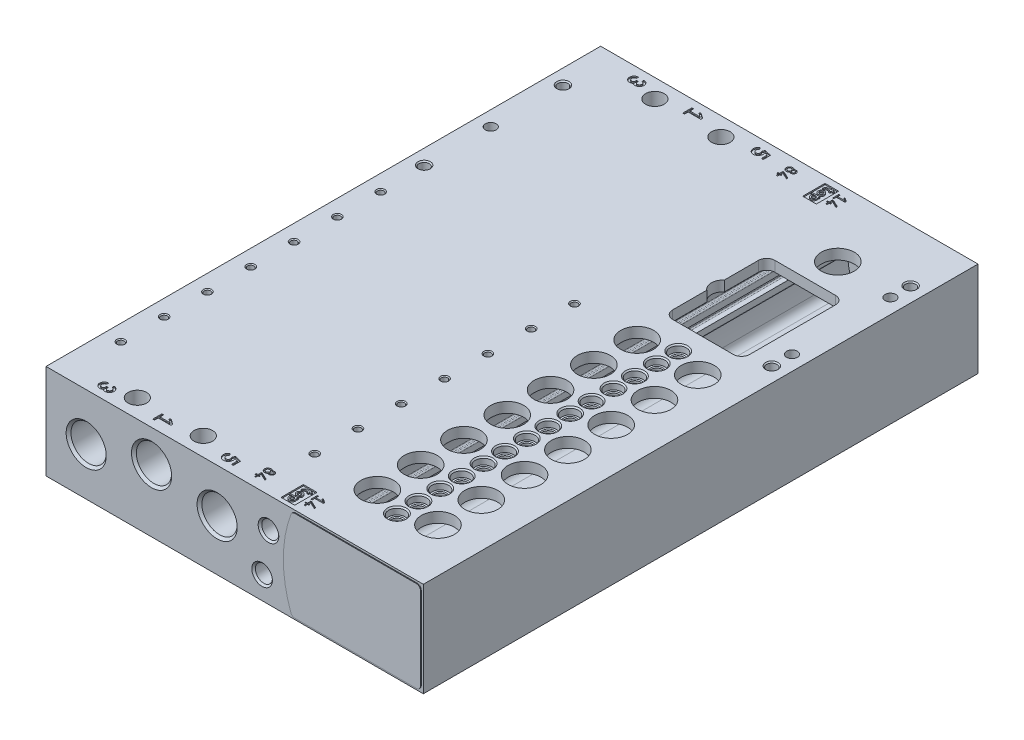
from build123d import *

# Parameters (mm, degrees)
SKIZZE1_W                             = 91.5
SKIZZE1_H                             = 23
AUFSATZ_LINEAR_AUSTRAGEN1_DEPTH       = 134.5
BOHRUNG1_D                            = 4.5
LINEARES_MUSTER1_COUNT                = 2
LINEARES_MUSTER1_PITCH                = 16
LINEARES_MUSTER1_COUNT_DIR2           = 2
LINEARES_MUSTER1_PITCH_DIR2           = 125.5
BOHRUNG2_D                            = 8
BOHRUNG2_DEPTH                        = 5
LINEARES_MUSTER2_COUNT                = 7
LINEARES_MUSTER2_PITCH                = 10.5
BOHRUNG3_D                            = 8
BOHRUNG3_DEPTH                        = 5
LINEARES_MUSTER3_COUNT                = 7
LINEARES_MUSTER3_PITCH                = 10.5
LINEARES_MUSTER4_COUNT                = 7
LINEARES_MUSTER4_PITCH                = 10.5
LINEARES_MUSTER5_COUNT                = 7
LINEARES_MUSTER5_PITCH                = 10.5
LINEARES_MUSTER6_COUNT                = 7
LINEARES_MUSTER6_PITCH                = 10.5
LINEARES_MUSTER7_COUNT                = 7
LINEARES_MUSTER7_PITCH                = 10.5
BOHRUNG6_D                            = 8
BOHRUNG6_DEPTH                        = 2.5
LINEARES_MUSTER8_COUNT                = 2
LINEARES_MUSTER8_PITCH                = 84.3
LINEARES_MUSTER8_COUNT_DIR2           = 2
LINEARES_MUSTER8_PITCH_DIR2           = 33.65
SKIZZE36_R                            = 1.3
SCHNITT_LINEAR_AUSTRAGEN1_DEPTH       = 11
LINEARES_MUSTER9_COUNT                = 2
LINEARES_MUSTER9_PITCH                = 85.236435871
LINEARES_MUSTER9_COUNT_DIR2           = 2
LINEARES_MUSTER9_PITCH_DIR2           = 85.047354456
SCHNITT_LINEAR_AUSTRAGEN2_DEPTH       = 5
LINEARES_MUSTER10_COUNT               = 7
LINEARES_MUSTER10_PITCH               = 10.5
LINEARES_MUSTER11_COUNT               = 7
LINEARES_MUSTER11_PITCH               = 10.5
AUFSATZ_LINEAR_AUSTRAGEN2_DEPTH       = 0.2
AUFSATZ_LINEAR_START                  = 0.2
AUFSATZ_LINEAR_AUSTRAGEN3_DEPTH       = 0.2
SCHNITT_LINEAR_AUSTRAGEN3_DEPTH       = 0.3
SCHNITT_LINEAR_AUSTRAGEN3_DEPTH_BACK  = 0.3
SCHNITT_LINEAR_AUSTRAGEN4_DEPTH       = 0.3
SCHNITT_LINEAR_AUSTRAGEN4_DEPTH_BACK  = 0.3
SCHNITT_LINEAR_AUSTRAGEN5_DEPTH       = 0.3
SCHNITT_LINEAR_AUSTRAGEN5_DEPTH_BACK  = 0.3
SKIZZE49_W                            = 3.3
SKIZZE49_H                            = 5.4
SCHNITT_LINEAR_AUSTRAGEN6_DEPTH       = 0.3
SCHNITT_LINEAR_AUSTRAGEN6_DEPTH_BACK  = 0.3
SKIZZE50_R                            = 0.35
SKIZZE50_R_2                          = 0.45
SCHNITT_LINEAR_AUSTRAGEN7_DEPTH       = 0.3
SCHNITT_LINEAR_AUSTRAGEN7_DEPTH_BACK  = 0.3
SCHNITT_LINEAR_AUSTRAGEN8_DEPTH       = 0.3
SCHNITT_LINEAR_AUSTRAGEN8_DEPTH_BACK  = 0.3
SCHNITT_LINEAR_AUSTRAGEN9_DEPTH       = 0.3
SCHNITT_LINEAR_AUSTRAGEN9_DEPTH_BACK  = 0.3
SCHNITT_LINEAR_AUSTRAGEN10_DEPTH      = 0.3
SCHNITT_LINEAR_AUSTRAGEN10_DEPTH_BACK = 0.3
SCHNITT_LINEAR_AUSTRAGEN11_DEPTH      = 0.3
SCHNITT_LINEAR_AUSTRAGEN11_DEPTH_BACK = 0.3
SCHNITT_LINEAR_AUSTRAGEN12_DEPTH      = 0.3
SCHNITT_LINEAR_AUSTRAGEN12_DEPTH_BACK = 0.3
SCHNITT_LINEAR_AUSTRAGEN13_DEPTH      = 0.3
SCHNITT_LINEAR_AUSTRAGEN13_DEPTH_BACK = 0.3
SKIZZE57_W                            = 3.3
SKIZZE57_H                            = 5.4
SCHNITT_LINEAR_AUSTRAGEN14_DEPTH      = 0.3
SCHNITT_LINEAR_AUSTRAGEN14_DEPTH_BACK = 0.3
SKIZZE58_R                            = 0.35
SKIZZE58_R_2                          = 0.45
SCHNITT_LINEAR_AUSTRAGEN15_DEPTH      = 0.3
SCHNITT_LINEAR_AUSTRAGEN15_DEPTH_BACK = 0.3
SCHNITT_LINEAR_AUSTRAGEN16_DEPTH      = 0.3
SCHNITT_LINEAR_AUSTRAGEN16_DEPTH_BACK = 0.3
SCHNITT_LINEAR_AUSTRAGEN17_DEPTH      = 0.3
SCHNITT_LINEAR_AUSTRAGEN17_DEPTH_BACK = 0.3
SCHNITT_LINEAR_AUSTRAGEN18_DEPTH      = 0.3
SCHNITT_LINEAR_AUSTRAGEN18_DEPTH_BACK = 0.3
SCHNITT_LINEAR_AUSTRAGEN19_DEPTH      = 0.3
SCHNITT_LINEAR_AUSTRAGEN19_DEPTH_BACK = 0.3
SCHNITT_LINEAR_AUSTRAGEN20_DEPTH      = 0.3
SCHNITT_LINEAR_AUSTRAGEN20_DEPTH_BACK = 0.3


with BuildPart() as part:
    # Skizze1 → Aufsatz-Linear austragen1 (new body)
    with BuildSketch(Plane.XY):
        with Locations((45.75, -11.5)):
            Rectangle(SKIZZE1_W, SKIZZE1_H)
        with BuildLine():
            Line((59.6, -8.95), (59.6, -10.45))
            ThreePointArc((59.6, -10.45), (59.687867966, -10.662132034), (59.9, -10.75))
            Line((59.9, -10.75), (61.1, -10.75))
            Line((61.1, -10.75), (61.1, -12.2))
            ThreePointArc((61.1, -12.2), (61.012132034, -12.412132034), (60.8, -12.5))
            Line((60.8, -12.5), (60.080522231, -12.5))
            ThreePointArc((60.080522231, -12.5), (59.863469442, -12.592905609), (59.780852797, -12.814079422))
            ThreePointArc((59.780852797, -12.814079422), (60.004661188, -15.267781074), (60.443309878, -17.692307692))
            ThreePointArc((60.443309878, -17.692307692), (61.145712302, -18.812788435), (62.393787743, -19.25))
            Line((62.393787743, -19.25), (83.8, -19.25))
            ThreePointArc((83.8, -19.25), (85.214213562, -18.664213562), (85.8, -17.25))
            Line((85.8, -17.25), (85.8, -10.75))
            Line((85.8, -10.75), (87, -10.75))
            ThreePointArc((87, -10.75), (87.212132034, -10.662132034), (87.3, -10.45))
            Line((87.3, -10.45), (87.3, -8.95))
            ThreePointArc((87.3, -8.95), (87.212132034, -8.737867966), (87, -8.65))
            Line((87, -8.65), (85.8, -8.65))
            Line((85.8, -8.65), (85.8, -4.5))
            ThreePointArc((85.8, -4.5), (85.214213562, -3.085786438), (83.8, -2.5))
            Line((83.8, -2.5), (62.710031949, -2.5))
            ThreePointArc((62.710031949, -2.5), (61.501090899, -2.906744986), (60.78388056, -3.961538462))
            ThreePointArc((60.78388056, -3.961538462), (60.457094135, -5.247217463), (60.191569139, -6.546931408))
            ThreePointArc((60.191569139, -6.546931408), (60.256707016, -6.792457037), (60.486838041, -6.9))
            Line((60.486838041, -6.9), (60.8, -6.9))
            ThreePointArc((60.8, -6.9), (61.012132034, -6.987867966), (61.1, -7.2))
            Line((61.1, -7.2), (61.1, -8.65))
            Line((61.1, -8.65), (59.9, -8.65))
            ThreePointArc((59.9, -8.65), (59.687867966, -8.737867966), (59.6, -8.95))
        make_face(mode=Mode.SUBTRACT)
    extrude(amount=AUFSATZ_LINEAR_AUSTRAGEN1_DEPTH)

    # Skizze2 → Schnitt-Rotation1 (revolve, cut)
    with BuildSketch(Plane(origin=(9.75, 0, 0), x_dir=(0, 0, -1), z_dir=(1, 0, 0))):
        Polygon((0, -11.5), (0, -16.364), (-0.581, -15.783), (-9.5, -15.783), (-9.5, -11.5), align=None)
    revolve(axis=Axis((9.75, -11.5, 9.5), (0, 0, -1)), mode=Mode.SUBTRACT)

    # Skizze3 → Schnitt-Rotation2 (revolve, cut)
    with BuildSketch(Plane(origin=(9.75, 0, 0), x_dir=(0, 0, -1), z_dir=(1, 0, 0))):
        Polygon((-125, -11.5), (-125, -15.783), (-133.919, -15.783), (-134.5, -16.364), (-134.5, -11.5), align=None)
    revolve(axis=Axis((9.75, -11.5, 134.5), (0, 0, -1)), mode=Mode.SUBTRACT)

    # Skizze4 → Schnitt-Rotation3 (revolve, cut)
    with BuildSketch(Plane(origin=(25.6, 0, 0), x_dir=(0, 0, -1), z_dir=(1, 0, 0))):
        Polygon((0, -7.8), (0, -12.664), (-0.581, -12.083), (-9.5, -12.083), (-9.5, -7.8), align=None)
    revolve(axis=Axis((25.6, -7.8, 9.5), (0, 0, -1)), mode=Mode.SUBTRACT)

    # Skizze5 → Schnitt-Rotation4 (revolve, cut)
    with BuildSketch(Plane(origin=(25.6, 0, 0), x_dir=(0, 0, -1), z_dir=(1, 0, 0))):
        Polygon((-125, -7.8), (-125, -12.083), (-133.919, -12.083), (-134.5, -12.664), (-134.5, -7.8), align=None)
    revolve(axis=Axis((25.6, -7.8, 134.5), (0, 0, -1)), mode=Mode.SUBTRACT)

    # Skizze6 → Schnitt-Rotation5 (revolve, cut)
    with BuildSketch(Plane(origin=(41.5, 0, 0), x_dir=(0, 0, -1), z_dir=(1, 0, 0))):
        Polygon((0, -10.6), (0, -15.464), (-0.581, -14.883), (-9.5, -14.883), (-9.5, -10.6), align=None)
    revolve(axis=Axis((41.5, -10.6, 9.5), (0, 0, -1)), mode=Mode.SUBTRACT)

    # Skizze7 → Schnitt-Rotation6 (revolve, cut)
    with BuildSketch(Plane(origin=(41.5, 0, 0), x_dir=(0, 0, -1), z_dir=(1, 0, 0))):
        Polygon((-125, -10.6), (-125, -14.883), (-133.919, -14.883), (-134.5, -15.464), (-134.5, -10.6), align=None)
    revolve(axis=Axis((41.5, -10.6, 134.5), (0, 0, -1)), mode=Mode.SUBTRACT)

    # Skizze8 → Schnitt-Rotation7 (revolve, cut)
    with BuildSketch(Plane(origin=(52.4, 0, 0), x_dir=(0, 0, -1), z_dir=(1, 0, 0))):
        Polygon((0, -17.5), (0, -20), (-0.433, -19.567), (-5, -19.567), (-5, -17.5), align=None)
    revolve(axis=Axis((52.4, -17.5, 5), (0, 0, -1)), mode=Mode.SUBTRACT)

    # Skizze9 → Schnitt-Rotation8 (revolve, cut)
    with BuildSketch(Plane(origin=(52.4, 0, 0), x_dir=(0, 0, -1), z_dir=(1, 0, 0))):
        Polygon((-129.5, -17.5), (-129.5, -19.567), (-134.067, -19.567), (-134.5, -20), (-134.5, -17.5), align=None)
    revolve(axis=Axis((52.4, -17.5, 134.5), (0, 0, -1)), mode=Mode.SUBTRACT)

    # Skizze10 → Schnitt-Rotation9 (revolve, cut)
    with BuildSketch(Plane(origin=(53.95, 0, 0), x_dir=(0, 0, -1), z_dir=(1, 0, 0))):
        Polygon((0, -7.5), (0, -10), (-0.433, -9.567), (-5, -9.567), (-5, -7.5), align=None)
    revolve(axis=Axis((53.95, -7.5, 5), (0, 0, -1)), mode=Mode.SUBTRACT)

    # Skizze11 → Schnitt-Rotation10 (revolve, cut)
    with BuildSketch(Plane(origin=(53.95, 0, 0), x_dir=(0, 0, -1), z_dir=(1, 0, 0))):
        Polygon((-129.5, -7.5), (-129.5, -9.567), (-134.067, -9.567), (-134.5, -10), (-134.5, -7.5), align=None)
    revolve(axis=Axis((53.95, -7.5, 134.5), (0, 0, -1)), mode=Mode.SUBTRACT)

    # Bohrung1 (through all)
    with Locations(Plane(origin=(0, 0, 0), x_dir=(1, 0, 0), z_dir=(0, 1, 0))):
        with Locations((17.65, -4.5)):
            bohrung1 = Hole(BOHRUNG1_D / 2)

    # Lineares Muster1: Bohrung1 2 × 2
    with Locations(*[(i * LINEARES_MUSTER1_PITCH, 0, j * LINEARES_MUSTER1_PITCH_DIR2) for i in range(LINEARES_MUSTER1_COUNT) for j in range(LINEARES_MUSTER1_COUNT_DIR2) if (i, j) != (0, 0)]):
        add(bohrung1, mode=Mode.SUBTRACT)

    # Bohrung2
    with Locations(Plane(origin=(0, 0, 0), x_dir=(1, 0, 0), z_dir=(0, 1, 0))):
        with Locations((80.8, -57.25)):
            bohrung2 = Hole(BOHRUNG2_D / 2, depth=BOHRUNG2_DEPTH)

    # Lineares Muster2: Bohrung2 ×7
    with Locations(*[(0, 0, i * LINEARES_MUSTER2_PITCH) for i in range(1, LINEARES_MUSTER2_COUNT)]):
        add(bohrung2, mode=Mode.SUBTRACT)

    # Bohrung3
    with Locations(Plane(origin=(0, 0, 0), x_dir=(1, 0, 0), z_dir=(0, 1, 0))):
        with Locations((66.1, -57.25)):
            bohrung3 = Hole(BOHRUNG3_D / 2, depth=BOHRUNG3_DEPTH)

    # Lineares Muster3: Bohrung3 ×7
    with Locations(*[(0, 0, i * LINEARES_MUSTER3_PITCH) for i in range(1, LINEARES_MUSTER3_COUNT)]):
        add(bohrung3, mode=Mode.SUBTRACT)

    # Skizze21 → Schnitt-Rotation11 (revolve, cut)
    with BuildSketch(Plane(origin=(73.45, 0, 0), x_dir=(0, 0, -1), z_dir=(1, 0, 0))):
        Polygon((-54.65, -3), (-56, -3), (-56, -1.9), (-56.2, -1.7), (-56.65, -1.7), (-56.65, -0.3), (-56.95, 0), (-54.65, 0), align=None)
    schnitt_rotation11 = revolve(axis=Axis((73.45, 0, 54.65), (0, -1, 0)), mode=Mode.SUBTRACT)

    # Lineares Muster4: Schnitt-Rotation11 ×7
    with Locations(*[(0, 0, i * LINEARES_MUSTER4_PITCH) for i in range(1, LINEARES_MUSTER4_COUNT)]):
        add(schnitt_rotation11, mode=Mode.SUBTRACT)

    # Skizze23 → Schnitt-Rotation12 (revolve, cut)
    with BuildSketch(Plane(origin=(73.45, 0, 0), x_dir=(0, 0, -1), z_dir=(1, 0, 0))):
        Polygon((-59.85, -3), (-61.2, -3), (-61.2, -1.9), (-61.4, -1.7), (-61.85, -1.7), (-61.85, -0.3), (-62.15, 0), (-59.85, 0), align=None)
    schnitt_rotation12 = revolve(axis=Axis((73.45, 0, 59.85), (0, -1, 0)), mode=Mode.SUBTRACT)

    # Lineares Muster5: Schnitt-Rotation12 ×7
    with Locations(*[(0, 0, i * LINEARES_MUSTER5_PITCH) for i in range(1, LINEARES_MUSTER5_COUNT)]):
        add(schnitt_rotation12, mode=Mode.SUBTRACT)

    # Skizze25 → Bohrung4 (revolve, cut)
    with BuildSketch(Plane(origin=(50.9, 0, 57.25), x_dir=(0, 0, 1), z_dir=(1, 0, 0))):
        Polygon((0, 0), (0, 5.752353936), (0.7835, 5.3), (0.7835, 0.2165), (1, 0), align=None)
    bohrung4 = revolve(axis=Axis((50.9, 14.308894879, 57.25), (0, -1, 0)), mode=Mode.SUBTRACT)

    # Lineares Muster6: Bohrung4 ×7
    with Locations(*[(0, 0, i * LINEARES_MUSTER6_PITCH) for i in range(1, LINEARES_MUSTER6_COUNT)]):
        add(bohrung4, mode=Mode.SUBTRACT)

    # Skizze28 → Bohrung5 (revolve, cut)
    with BuildSketch(Plane(origin=(3.9, 0, 57.25), x_dir=(0, 0, 1), z_dir=(1, 0, 0))):
        Polygon((0, 0), (0, 5.752353936), (0.7835, 5.3), (0.7835, 0.2165), (1, 0), align=None)
    bohrung5 = revolve(axis=Axis((3.9, 14.308894879, 57.25), (0, -1, 0)), mode=Mode.SUBTRACT)

    # Lineares Muster7: Bohrung5 ×7
    with Locations(*[(0, 0, i * LINEARES_MUSTER7_PITCH) for i in range(1, LINEARES_MUSTER7_COUNT)]):
        add(bohrung5, mode=Mode.SUBTRACT)

    # Bohrung6
    with Locations(Plane(origin=(0, 0, 0), x_dir=(1, 0, 0), z_dir=(0, 1, 0))):
        with Locations((74, -16.5)):
            Hole(BOHRUNG6_D / 2, depth=BOHRUNG6_DEPTH)

    # Skizze33 → Bohrung7 (revolve, cut)
    with BuildSketch(Plane(origin=(3.6, 0, 12.75), x_dir=(0, 0, 1), z_dir=(1, 0, 0))):
        Polygon((0, 0), (0, 7.709852156), (1.2295, 7), (1.2295, 0.2705), (1.5, 0), align=None)
    bohrung7 = revolve(axis=Axis((3.6, 14.308894879, 12.75), (0, -1, 0)), mode=Mode.SUBTRACT)

    # Lineares Muster8: Bohrung7 2 × 2
    with Locations(*[(i * LINEARES_MUSTER8_PITCH, 0, j * LINEARES_MUSTER8_PITCH_DIR2) for i in range(LINEARES_MUSTER8_COUNT) for j in range(LINEARES_MUSTER8_COUNT_DIR2) if (i, j) != (0, 0)]):
        add(bohrung7, mode=Mode.SUBTRACT)

    # Skizze36 → Schnitt-Linear austragen1 (cut)
    with BuildSketch(Plane(origin=(0, -9, 0), x_dir=(1, 0, 0), z_dir=(0, 1, 0))):
        with Locations((3.6, -30.25)):
            Circle(SKIZZE36_R)
    schnitt_linear_austragen1 = extrude(amount=SCHNITT_LINEAR_AUSTRAGEN1_DEPTH, mode=Mode.SUBTRACT)

    # Lineares Muster9: Schnitt-Linear austragen1 2 × 2, 1 skipped
    with Locations(*[Vector(0.9890136669666844, 0, -0.14782410680640817) * (i * LINEARES_MUSTER9_PITCH) + Vector(0.991212490253374, 0, 0.13227924691993415) * (j * LINEARES_MUSTER9_PITCH_DIR2) for i in range(LINEARES_MUSTER9_COUNT) for j in range(LINEARES_MUSTER9_COUNT_DIR2) if (i, j) not in ((0, 0), (1, 1))]):
        add(schnitt_linear_austragen1, mode=Mode.SUBTRACT)

    # Skizze38 → Schnitt-Linear austragen2 (cut)
    with BuildSketch(Plane(origin=(0, 0, 0), x_dir=(1, 0, 0), z_dir=(0, 1, 0))):
        with BuildLine():
            Line((64.1, -38.371320344), (64.1, -46.65))
            ThreePointArc((64.1, -46.65), (64.685786438, -48.064213562), (66.1, -48.65))
            Line((66.1, -48.65), (80.8, -48.65))
            ThreePointArc((80.8, -48.65), (82.214213562, -48.064213562), (82.8, -46.65))
            Line((82.8, -46.65), (82.8, -25.85))
            ThreePointArc((82.8, -25.85), (82.214213562, -24.435786438), (80.8, -23.85))
            Line((80.8, -23.85), (66.1, -23.85))
            ThreePointArc((66.1, -23.85), (64.685786438, -24.435786438), (64.1, -25.85))
            Line((64.1, -25.85), (64.1, -34.128679656))
            ThreePointArc((64.1, -34.128679656), (63.1, -36.25), (64.1, -38.371320344))
        make_face()
    extrude(amount=-SCHNITT_LINEAR_AUSTRAGEN2_DEPTH, mode=Mode.SUBTRACT)

    # Skizze39 → Schnitt-Rotation13 (revolve, cut)
    with BuildSketch(Plane.XY.offset(20)):
        Polygon((0, -4.75), (0, -2.25), (0.433, -2.683), (41, -2.683), (41.462457566, -2.95), (46, -2.95), (46, -3.1), (55.75, -3.1), (56.702627944, -4.75), align=None)
    revolve(axis=Axis((56.702627944, -4.75, 20), (-1, 0, 0)), mode=Mode.SUBTRACT)

    # Skizze40 → Schnitt-Rotation14 (revolve, cut)
    with BuildSketch(Plane.XY.offset(36)):
        Polygon((0, -4.75), (0, -2.25), (0.433, -2.683), (13, -2.683), (14.193383006, -4.75), align=None)
    revolve(axis=Axis((14.193383006, -4.75, 36), (-1, 0, 0)), mode=Mode.SUBTRACT)

    # Skizze41 → Schnitt-Rotation15 (revolve, cut)
    with BuildSketch(Plane.XY.offset(57.25)):
        Polygon((0, -17.6), (0, -15.1), (0.433, -15.533), (6, -15.533), (6, -17.6), align=None)
    schnitt_rotation15 = revolve(axis=Axis((6, -17.6, 57.25), (-1, 0, 0)), mode=Mode.SUBTRACT)

    # Lineares Muster10: Schnitt-Rotation15 ×7
    with Locations(*[(0, 0, i * LINEARES_MUSTER10_PITCH) for i in range(1, LINEARES_MUSTER10_COUNT)]):
        add(schnitt_rotation15, mode=Mode.SUBTRACT)

    # Skizze43 → Schnitt-Rotation16 (revolve, cut)
    with BuildSketch(Plane.XY.offset(53.15)):
        Polygon((0, -5.4), (0, -2.9), (0.433, -3.333), (6, -3.333), (6, -5.4), align=None)
    schnitt_rotation16 = revolve(axis=Axis((6, -5.4, 53.15), (-1, 0, 0)), mode=Mode.SUBTRACT)

    # Lineares Muster11: Schnitt-Rotation16 ×7
    with Locations(*[(0, 0, i * LINEARES_MUSTER11_PITCH) for i in range(1, LINEARES_MUSTER11_COUNT)]):
        add(schnitt_rotation16, mode=Mode.SUBTRACT)

    # Skizze45 → Aufsatz-Linear austragen2 (add)
    with BuildSketch(Plane.XY):
        with BuildLine():
            Line((60.528684822, -22.5), (90, -22.5))
            ThreePointArc((90, -22.5), (90.707106781, -22.207106781), (91, -21.5))
            Line((91, -21.5), (91, -1.5))
            ThreePointArc((91, -1.5), (90.707106781, -0.792893219), (90, -0.5))
            Line((90, -0.5), (60.528684822, -0.5))
            ThreePointArc((60.528684822, -0.5), (59.956333351, -0.67999159), (59.590018782, -1.155172414))
            ThreePointArc((59.590018782, -1.155172414), (57.75, -11.5), (59.590018782, -21.844827586))
            ThreePointArc((59.590018782, -21.844827586), (59.956333351, -22.32000841), (60.528684822, -22.5))
        make_face()
    extrude(amount=-AUFSATZ_LINEAR_AUSTRAGEN2_DEPTH)

    # Skizze46 → Aufsatz-Linear austragen3 (add)
    with BuildSketch(Plane.XY.offset(134.5).offset(AUFSATZ_LINEAR_START)):
        with BuildLine():
            Line((60.528684822, -22.5), (90, -22.5))
            ThreePointArc((90, -22.5), (90.707106781, -22.207106781), (91, -21.5))
            Line((91, -21.5), (91, -1.5))
            ThreePointArc((91, -1.5), (90.707106781, -0.792893219), (90, -0.5))
            Line((90, -0.5), (60.528684822, -0.5))
            ThreePointArc((60.528684822, -0.5), (59.956333351, -0.67999159), (59.590018782, -1.155172414))
            ThreePointArc((59.590018782, -1.155172414), (57.75, -11.5), (59.590018782, -21.844827586))
            ThreePointArc((59.590018782, -21.844827586), (59.956333351, -22.32000841), (60.528684822, -22.5))
        make_face()
    extrude(amount=-AUFSATZ_LINEAR_AUSTRAGEN3_DEPTH)

    # Skizze47 → Schnitt-Linear austragen3 (cut, two sides: drawn at the far end of the back side and taken through both)
    with BuildSketch(Plane(origin=(0, 0, 0), x_dir=(1, 0, 0), z_dir=(0, 1, 0)).offset(-SCHNITT_LINEAR_AUSTRAGEN3_DEPTH_BACK)):
        Polygon((60, -3.75), (60.3, -3.75), (60.3, -3.15), (62.4, -3.15), (62.4, -2.85), (61.476056236, -2.203047611), (61.335102342, -2.404350633), (61.971555598, -2.85), (60.3, -2.85), (60.3, -2.25), (60, -2.25), align=None)
    extrude(amount=SCHNITT_LINEAR_AUSTRAGEN3_DEPTH + SCHNITT_LINEAR_AUSTRAGEN3_DEPTH_BACK, mode=Mode.SUBTRACT)

    # Skizze48 → Schnitt-Linear austragen4 (cut, two sides: drawn at the far end of the back side and taken through both)
    with BuildSketch(Plane(origin=(0, 0, 0), x_dir=(1, 0, 0), z_dir=(0, 1, 0)).offset(-SCHNITT_LINEAR_AUSTRAGEN4_DEPTH_BACK)):
        Polygon((60, -5.3), (60.4, -5.3), (60.4, -5.83), (60.7, -5.83), (60.7, -5.3), (61, -5.3), (61, -5), (60.7, -5), (60.7, -4.539892297), (62.4, -5.332615316), (62.4, -5.001601941), (60.616623883, -4.17), (60.4, -4.17), (60.4, -5), (60, -5), align=None)
    extrude(amount=SCHNITT_LINEAR_AUSTRAGEN4_DEPTH + SCHNITT_LINEAR_AUSTRAGEN4_DEPTH_BACK, mode=Mode.SUBTRACT)

    # Skizze49 → Schnitt-Linear austragen5 (cut, two sides: drawn at the far end of the back side and taken through both)
    with BuildSketch(Plane(origin=(0, 0, 0), x_dir=(1, 0, 0), z_dir=(0, 1, 0)).offset(-SCHNITT_LINEAR_AUSTRAGEN5_DEPTH_BACK)):
        with Locations((57.65, -4.3)):
            Rectangle(SKIZZE49_W, SKIZZE49_H)
        with BuildLine():
            Line((56.75, -2.95), (57.05, -2.95))
            ThreePointArc((57.05, -2.95), (57.181801948, -2.631801948), (57.5, -2.5))
            Line((57.5, -2.5), (58.1, -2.5))
            Line((58.1, -2.5), (58.1, -2.8))
            Line((58.1, -2.8), (58.4, -2.8))
            Line((58.4, -2.8), (58.4, -2.5))
            Line((58.4, -2.5), (58.85, -2.5))
            Line((58.85, -2.5), (58.85, -2.2))
            Line((58.85, -2.2), (58.4, -2.2))
            Line((58.4, -2.2), (58.4, -1.9))
            Line((58.4, -1.9), (58.1, -1.9))
            Line((58.1, -1.9), (58.1, -2.2))
            Line((58.1, -2.2), (57.5, -2.2))
            ThreePointArc((57.5, -2.2), (56.969669914, -2.419669914), (56.75, -2.95))
        make_face(mode=Mode.SUBTRACT)
        with BuildLine():
            Line((58.137976703, -4.394316784), (57.877973988, -4.244204146))
            ThreePointArc((57.877973988, -4.244204146), (57.110288568, -3.775), (57.900473988, -4.205233002))
            Line((57.900473988, -4.205233002), (58.160476703, -4.35534564))
            ThreePointArc((58.160476703, -4.35534564), (56.850480947, -3.625), (58.137976703, -4.394316784))
        make_face(mode=Mode.SUBTRACT)
        with BuildLine():
            Line((56.375, -5.35), (57.5, -5.35))
            ThreePointArc((57.5, -5.35), (57.582158384, -6.242436436), (57.338445056, -5.38))
            Line((57.338445056, -5.38), (56.878630545, -5.38))
            ThreePointArc((56.878630545, -5.38), (57.51841639, -6.549773857), (58.1, -5.35))
            Line((58.1, -5.35), (58.25, -5.35))
            Line((58.25, -5.35), (58.25, -5.05))
            Line((58.25, -5.05), (56.375, -5.05))
            Line((56.375, -5.05), (56.375, -5.35))
        make_face(mode=Mode.SUBTRACT)
    extrude(amount=SCHNITT_LINEAR_AUSTRAGEN5_DEPTH + SCHNITT_LINEAR_AUSTRAGEN5_DEPTH_BACK, mode=Mode.SUBTRACT)

    # Skizze50 → Schnitt-Linear austragen6 (cut, two sides: drawn at the far end of the back side and taken through both)
    with BuildSketch(Plane(origin=(0, 0, 0), x_dir=(1, 0, 0), z_dir=(0, 1, 0)).offset(-SCHNITT_LINEAR_AUSTRAGEN6_DEPTH_BACK)):
        with BuildLine():
            ThreePointArc((49.389473684, -2.459148102), (48, -3), (49.389473684, -3.540851898))
            ThreePointArc((49.389473684, -3.540851898), (50.4, -3), (49.389473684, -2.459148102))
        make_face()
        with Locations((49.75, -3)):
            Circle(SKIZZE50_R, mode=Mode.SUBTRACT)
        with Locations((48.8, -3)):
            Circle(SKIZZE50_R_2, mode=Mode.SUBTRACT)
    extrude(amount=SCHNITT_LINEAR_AUSTRAGEN6_DEPTH + SCHNITT_LINEAR_AUSTRAGEN6_DEPTH_BACK, mode=Mode.SUBTRACT)

    # Skizze51 → Schnitt-Linear austragen7 (cut, two sides: drawn at the far end of the back side and taken through both)
    with BuildSketch(Plane(origin=(0, 0, 0), x_dir=(1, 0, 0), z_dir=(0, 1, 0)).offset(-SCHNITT_LINEAR_AUSTRAGEN7_DEPTH_BACK)):
        Polygon((48, -5.3), (48.4, -5.3), (48.4, -5.83), (48.7, -5.83), (48.7, -5.3), (49, -5.3), (49, -5), (48.7, -5), (48.7, -4.539892297), (50.4, -5.332615316), (50.4, -5.001601941), (48.616623883, -4.17), (48.4, -4.17), (48.4, -5), (48, -5), align=None)
    extrude(amount=SCHNITT_LINEAR_AUSTRAGEN7_DEPTH + SCHNITT_LINEAR_AUSTRAGEN7_DEPTH_BACK, mode=Mode.SUBTRACT)

    # Skizze52 → Schnitt-Linear austragen8 (cut, two sides: drawn at the far end of the back side and taken through both)
    with BuildSketch(Plane(origin=(0, 0, 0), x_dir=(1, 0, 0), z_dir=(0, 1, 0)).offset(-SCHNITT_LINEAR_AUSTRAGEN8_DEPTH_BACK)):
        with BuildLine():
            Line((42.297073247, -2.492945813), (43.066, -2.685039581))
            Line((43.066, -2.685039581), (43.066, -4.095))
            Line((43.066, -4.095), (43.504, -4.095))
            Line((43.504, -4.095), (43.504, -2.343))
            Line((43.504, -2.343), (41.84636398, -1.92888832))
            Line((41.84636398, -1.92888832), (41.6425, -2.489))
            Line((41.6425, -2.489), (41.6425, -2.613720309))
            ThreePointArc((41.6425, -2.613720309), (41.070319266, -3.568376223), (40.9855, -2.45861751))
            Line((40.9855, -2.45861751), (40.625148843, -1.943982724))
            ThreePointArc((40.625148843, -1.943982724), (40.828748291, -4.144391062), (42.297073247, -2.492945813))
        make_face()
    extrude(amount=SCHNITT_LINEAR_AUSTRAGEN8_DEPTH + SCHNITT_LINEAR_AUSTRAGEN8_DEPTH_BACK, mode=Mode.SUBTRACT)

    # Skizze53 → Schnitt-Linear austragen9 (cut, two sides: drawn at the far end of the back side and taken through both)
    with BuildSketch(Plane(origin=(0, 0, 0), x_dir=(1, 0, 0), z_dir=(0, 1, 0)).offset(-SCHNITT_LINEAR_AUSTRAGEN9_DEPTH_BACK)):
        Polygon((24, -4.095), (24.438, -4.095), (24.438, -3.219), (27.504, -3.219), (27.504, -2.781), (26.155042104, -1.836449512), (25.94924942, -2.130351924), (26.878471173, -2.781), (24.438, -2.781), (24.438, -1.905), (24, -1.905), align=None)
    extrude(amount=SCHNITT_LINEAR_AUSTRAGEN9_DEPTH + SCHNITT_LINEAR_AUSTRAGEN9_DEPTH_BACK, mode=Mode.SUBTRACT)

    # Skizze54 → Schnitt-Linear austragen10 (cut, two sides: drawn at the far end of the back side and taken through both)
    with BuildSketch(Plane(origin=(0, 0, 0), x_dir=(1, 0, 0), z_dir=(0, 1, 0)).offset(-SCHNITT_LINEAR_AUSTRAGEN10_DEPTH_BACK)):
        with BuildLine():
            Line((12.409, -1.905), (12.409, -2.416))
            ThreePointArc((12.409, -2.416), (12.993, -3), (12.409, -3.584))
            ThreePointArc((12.409, -3.584), (12.09928723, -3.45571277), (11.971, -3.146))
            Line((11.971, -3.146), (11.971, -2.854))
            Line((11.971, -2.854), (11.533, -2.854))
            Line((11.533, -2.854), (11.533, -3.146))
            ThreePointArc((11.533, -3.146), (11.40471277, -3.45571277), (11.095, -3.584))
            ThreePointArc((11.095, -3.584), (10.511, -3), (11.095, -2.416))
            Line((11.095, -2.416), (11.095, -1.905))
            ThreePointArc((11.095, -1.905), (10.056191789, -3.346269404), (11.752, -3.876))
            ThreePointArc((11.752, -3.876), (13.447808211, -3.346269404), (12.409, -1.905))
        make_face()
    extrude(amount=SCHNITT_LINEAR_AUSTRAGEN10_DEPTH + SCHNITT_LINEAR_AUSTRAGEN10_DEPTH_BACK, mode=Mode.SUBTRACT)

    # Skizze55 → Schnitt-Linear austragen11 (cut, two sides: drawn at the far end of the back side and taken through both)
    with BuildSketch(Plane(origin=(0, 0, 0), x_dir=(1, 0, 0), z_dir=(0, 1, 0)).offset(-SCHNITT_LINEAR_AUSTRAGEN11_DEPTH_BACK)):
        Polygon((60, -130.25), (60.3, -130.25), (60.3, -129.65), (62.4, -129.65), (62.4, -129.35), (61.476056236, -128.703047611), (61.335102342, -128.904350633), (61.971555598, -129.35), (60.3, -129.35), (60.3, -128.75), (60, -128.75), align=None)
    extrude(amount=SCHNITT_LINEAR_AUSTRAGEN11_DEPTH + SCHNITT_LINEAR_AUSTRAGEN11_DEPTH_BACK, mode=Mode.SUBTRACT)

    # Skizze56 → Schnitt-Linear austragen12 (cut, two sides: drawn at the far end of the back side and taken through both)
    with BuildSketch(Plane(origin=(0, 0, 0), x_dir=(1, 0, 0), z_dir=(0, 1, 0)).offset(-SCHNITT_LINEAR_AUSTRAGEN12_DEPTH_BACK)):
        Polygon((60, -131.8), (60.4, -131.8), (60.4, -132.33), (60.7, -132.33), (60.7, -131.8), (61, -131.8), (61, -131.5), (60.7, -131.5), (60.7, -131.039892297), (62.4, -131.832615316), (62.4, -131.501601941), (60.616623883, -130.67), (60.4, -130.67), (60.4, -131.5), (60, -131.5), align=None)
    extrude(amount=SCHNITT_LINEAR_AUSTRAGEN12_DEPTH + SCHNITT_LINEAR_AUSTRAGEN12_DEPTH_BACK, mode=Mode.SUBTRACT)

    # Skizze57 → Schnitt-Linear austragen13 (cut, two sides: drawn at the far end of the back side and taken through both)
    with BuildSketch(Plane(origin=(0, 0, 0), x_dir=(1, 0, 0), z_dir=(0, 1, 0)).offset(-SCHNITT_LINEAR_AUSTRAGEN13_DEPTH_BACK)):
        with Locations((57.65, -130.8)):
            Rectangle(SKIZZE57_W, SKIZZE57_H)
        with BuildLine():
            Line((56.75, -129.45), (57.05, -129.45))
            ThreePointArc((57.05, -129.45), (57.181801948, -129.131801948), (57.5, -129))
            Line((57.5, -129), (58.1, -129))
            Line((58.1, -129), (58.1, -129.3))
            Line((58.1, -129.3), (58.4, -129.3))
            Line((58.4, -129.3), (58.4, -129))
            Line((58.4, -129), (58.85, -129))
            Line((58.85, -129), (58.85, -128.7))
            Line((58.85, -128.7), (58.4, -128.7))
            Line((58.4, -128.7), (58.4, -128.4))
            Line((58.4, -128.4), (58.1, -128.4))
            Line((58.1, -128.4), (58.1, -128.7))
            Line((58.1, -128.7), (57.5, -128.7))
            ThreePointArc((57.5, -128.7), (56.969669914, -128.919669914), (56.75, -129.45))
        make_face(mode=Mode.SUBTRACT)
        with BuildLine():
            Line((58.137976703, -130.894316784), (57.877973988, -130.744204146))
            ThreePointArc((57.877973988, -130.744204146), (57.110288568, -130.275), (57.900473988, -130.705233002))
            Line((57.900473988, -130.705233002), (58.160476703, -130.85534564))
            ThreePointArc((58.160476703, -130.85534564), (56.850480947, -130.125), (58.137976703, -130.894316784))
        make_face(mode=Mode.SUBTRACT)
        with BuildLine():
            Line((56.375, -131.85), (57.5, -131.85))
            ThreePointArc((57.5, -131.85), (57.582158384, -132.742436436), (57.338445056, -131.88))
            Line((57.338445056, -131.88), (56.878630545, -131.88))
            ThreePointArc((56.878630545, -131.88), (57.51841639, -133.049773857), (58.1, -131.85))
            Line((58.1, -131.85), (58.25, -131.85))
            Line((58.25, -131.85), (58.25, -131.55))
            Line((58.25, -131.55), (56.375, -131.55))
            Line((56.375, -131.55), (56.375, -131.85))
        make_face(mode=Mode.SUBTRACT)
    extrude(amount=SCHNITT_LINEAR_AUSTRAGEN13_DEPTH + SCHNITT_LINEAR_AUSTRAGEN13_DEPTH_BACK, mode=Mode.SUBTRACT)

    # Skizze58 → Schnitt-Linear austragen14 (cut, two sides: drawn at the far end of the back side and taken through both)
    with BuildSketch(Plane(origin=(0, 0, 0), x_dir=(1, 0, 0), z_dir=(0, 1, 0)).offset(-SCHNITT_LINEAR_AUSTRAGEN14_DEPTH_BACK)):
        with BuildLine():
            ThreePointArc((49.389473684, -128.959148102), (48, -129.5), (49.389473684, -130.040851898))
            ThreePointArc((49.389473684, -130.040851898), (50.4, -129.5), (49.389473684, -128.959148102))
        make_face()
        with Locations((49.75, -129.5)):
            Circle(SKIZZE58_R, mode=Mode.SUBTRACT)
        with Locations((48.8, -129.5)):
            Circle(SKIZZE58_R_2, mode=Mode.SUBTRACT)
    extrude(amount=SCHNITT_LINEAR_AUSTRAGEN14_DEPTH + SCHNITT_LINEAR_AUSTRAGEN14_DEPTH_BACK, mode=Mode.SUBTRACT)

    # Skizze59 → Schnitt-Linear austragen15 (cut, two sides: drawn at the far end of the back side and taken through both)
    with BuildSketch(Plane(origin=(0, 0, 0), x_dir=(1, 0, 0), z_dir=(0, 1, 0)).offset(-SCHNITT_LINEAR_AUSTRAGEN15_DEPTH_BACK)):
        Polygon((48, -131.8), (48.4, -131.8), (48.4, -132.33), (48.7, -132.33), (48.7, -131.8), (49, -131.8), (49, -131.5), (48.7, -131.5), (48.7, -131.039892297), (50.4, -131.832615316), (50.4, -131.501601941), (48.616623883, -130.67), (48.4, -130.67), (48.4, -131.5), (48, -131.5), align=None)
    extrude(amount=SCHNITT_LINEAR_AUSTRAGEN15_DEPTH + SCHNITT_LINEAR_AUSTRAGEN15_DEPTH_BACK, mode=Mode.SUBTRACT)

    # Skizze60 → Schnitt-Linear austragen16 (cut, two sides: drawn at the far end of the back side and taken through both)
    with BuildSketch(Plane(origin=(0, 0, 0), x_dir=(1, 0, 0), z_dir=(0, 1, 0)).offset(-SCHNITT_LINEAR_AUSTRAGEN16_DEPTH_BACK)):
        with BuildLine():
            Line((42.297073247, -130.992945813), (43.066, -131.185039581))
            Line((43.066, -131.185039581), (43.066, -132.595))
            Line((43.066, -132.595), (43.504, -132.595))
            Line((43.504, -132.595), (43.504, -130.843))
            Line((43.504, -130.843), (41.84636398, -130.42888832))
            Line((41.84636398, -130.42888832), (41.6425, -130.989))
            Line((41.6425, -130.989), (41.6425, -131.113720309))
            ThreePointArc((41.6425, -131.113720309), (41.070319266, -132.068376223), (40.9855, -130.95861751))
            Line((40.9855, -130.95861751), (40.625148843, -130.443982724))
            ThreePointArc((40.625148843, -130.443982724), (40.828748291, -132.644391062), (42.297073247, -130.992945813))
        make_face()
    extrude(amount=SCHNITT_LINEAR_AUSTRAGEN16_DEPTH + SCHNITT_LINEAR_AUSTRAGEN16_DEPTH_BACK, mode=Mode.SUBTRACT)

    # Skizze61 → Schnitt-Linear austragen17 (cut, two sides: drawn at the far end of the back side and taken through both)
    with BuildSketch(Plane(origin=(0, 0, 0), x_dir=(1, 0, 0), z_dir=(0, 1, 0)).offset(-SCHNITT_LINEAR_AUSTRAGEN17_DEPTH_BACK)):
        Polygon((24, -132.595), (24.438, -132.595), (24.438, -131.719), (27.504, -131.719), (27.504, -131.281), (26.155042104, -130.336449512), (25.94924942, -130.630351924), (26.878471173, -131.281), (24.438, -131.281), (24.438, -130.405), (24, -130.405), align=None)
    extrude(amount=SCHNITT_LINEAR_AUSTRAGEN17_DEPTH + SCHNITT_LINEAR_AUSTRAGEN17_DEPTH_BACK, mode=Mode.SUBTRACT)

    # Skizze62 → Schnitt-Linear austragen18 (cut, two sides: drawn at the far end of the back side and taken through both)
    with BuildSketch(Plane(origin=(0, 0, 0), x_dir=(1, 0, 0), z_dir=(0, 1, 0)).offset(-SCHNITT_LINEAR_AUSTRAGEN18_DEPTH_BACK)):
        with BuildLine():
            Line((12.409, -130.405), (12.409, -130.916))
            ThreePointArc((12.409, -130.916), (12.993, -131.5), (12.409, -132.084))
            ThreePointArc((12.409, -132.084), (12.09928723, -131.95571277), (11.971, -131.646))
            Line((11.971, -131.646), (11.971, -131.354))
            Line((11.971, -131.354), (11.533, -131.354))
            Line((11.533, -131.354), (11.533, -131.646))
            ThreePointArc((11.533, -131.646), (11.40471277, -131.95571277), (11.095, -132.084))
            ThreePointArc((11.095, -132.084), (10.511, -131.5), (11.095, -130.916))
            Line((11.095, -130.916), (11.095, -130.405))
            ThreePointArc((11.095, -130.405), (10.056191789, -131.846269404), (11.752, -132.376))
            ThreePointArc((11.752, -132.376), (13.447808211, -131.846269404), (12.409, -130.405))
        make_face()
    extrude(amount=SCHNITT_LINEAR_AUSTRAGEN18_DEPTH + SCHNITT_LINEAR_AUSTRAGEN18_DEPTH_BACK, mode=Mode.SUBTRACT)

    # Skizze63 → Schnitt-Linear austragen19 (cut, two sides: drawn at the far end of the back side and taken through both)
    with BuildSketch(Plane(origin=(0, 0, 0), x_dir=(0, 0, -1), z_dir=(1, 0, 0)).offset(-SCHNITT_LINEAR_AUSTRAGEN19_DEPTH_BACK)):
        with BuildLine():
            Line((-42.974466792, -4.326231895), (-41.658075658, -5.562))
            Line((-41.658075658, -5.562), (-43.3085, -5.562))
            Line((-43.3085, -5.562), (-43.3085, -6))
            Line((-43.3085, -6), (-41.1915, -6))
            Line((-41.1915, -6), (-41.1915, -5.399243438))
            Line((-41.1915, -5.399243438), (-42.67468743, -4.006894559))
            ThreePointArc((-42.67468743, -4.006894559), (-42.496476875, -2.985053427), (-41.6295, -3.5545))
            Line((-41.6295, -3.5545), (-41.1915, -3.5545))
            ThreePointArc((-41.1915, -3.5545), (-42.670460552, -2.583091139), (-42.974466792, -4.326231895))
        make_face()
    extrude(amount=SCHNITT_LINEAR_AUSTRAGEN19_DEPTH + SCHNITT_LINEAR_AUSTRAGEN19_DEPTH_BACK, mode=Mode.SUBTRACT)

    # Skizze64 → Schnitt-Linear austragen20 (cut, two sides: drawn at the far end of the back side and taken through both)
    with BuildSketch(Plane(origin=(0, 0, 0), x_dir=(0, 0, -1), z_dir=(1, 0, 0)).offset(-SCHNITT_LINEAR_AUSTRAGEN20_DEPTH_BACK)):
        Polygon((-43.4618, -18.978), (-43.4618, -19.416), (-42.688, -19.416), (-42.688, -20), (-42.25, -20), (-42.25, -19.416), (-41.0382, -19.416), (-41.0382, -19.09972913), (-42.252338833, -16.496), (-42.735618362, -16.496), (-41.578242754, -18.978), (-42.25, -18.978), (-42.25, -18.54), (-42.688, -18.54), (-42.688, -18.978), align=None)
    extrude(amount=SCHNITT_LINEAR_AUSTRAGEN20_DEPTH + SCHNITT_LINEAR_AUSTRAGEN20_DEPTH_BACK, mode=Mode.SUBTRACT)


solid = part.part
